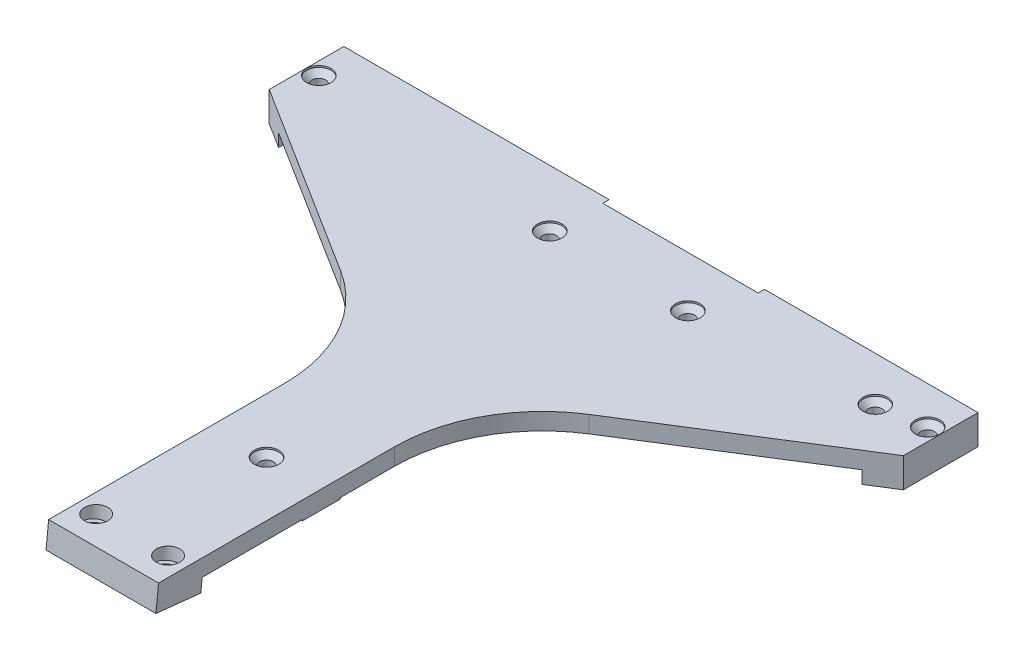
from build123d import *
from build123d.topology import SkipClean

# Parameters (mm, degrees)
BOSS_EXTRU_1_DEPTH                   = 4
BOSS_EXTRU_6_DEPTH                   = 3
ENL_V_MAT_EXTRU_9_DEPTH              = 1.5
ESQUISSE18_W                         = 26
ESQUISSE18_H                         = 4
BOSS_EXTRU_5_DEPTH                   = 3.5
ESQUISSE24_W                         = 26
ESQUISSE24_H                         = 9
ESQUISSE24_R                         = 1.6
BOSS_EXTRU_7_DEPTH                   = 0.3
ESQUISSE25_W                         = 26
ESQUISSE25_H                         = 12
BOSS_EXTRU_8_DEPTH                   = 3
ENL_V_MAT_EXTRU_13_REACH             = 155.177
ENL_V_MAT_EXTRU_13_DIRECTION_2_REACH = 155.177
ENL_V_MAT_EXTRU_14_REACH             = 155.177
ENL_V_MAT_EXTRU_14_DIRECTION_2_REACH = 155.177
ENL_V_MAT_EXTRU_15_REACH             = 161.061
ESQUISSE38_W                         = 26
ESQUISSE38_H                         = 10.68641461
ESQUISSE38_R                         = 1.6
BOSS_EXTRU_10_DEPTH                  = 0.09


# Read off the part's stored shape, not the designer's step: Fraisage pour vis à tête fraisée à 6 pans creux M31
with BuildPart() as part:
    # Esquisse1 → Boss.-Extru.1 (new body)
    with BuildSketch(Plane(origin=(0, 0, 0), x_dir=(1, 0, 0), z_dir=(0, 1, 0))):
        with BuildLine():
            Line((-13, -130), (-13, -76))
            ThreePointArc((-13, -76), (-17.360668588, -59.081626241), (-29.356078322, -46.378990826))
            Line((-29.356078322, -46.378990826), (-75, -17.65))
            Line((-75, -17.65), (-75, 0))
            Line((-75, 0), (75, 0))
            Line((75, 0), (75, -17.65))
            Line((75, -17.65), (29.356078322, -46.378990826))
            ThreePointArc((29.356078322, -46.378990826), (17.360668588, -59.081626241), (13, -76))
            Line((13, -76), (13, -130))
            Line((13, -130), (-13, -130))
        make_face()
    extrude(amount=BOSS_EXTRU_1_DEPTH)

    # Esquisse21 → Boss.-Extru.6 (add)
    with BuildSketch(Plane(origin=(0, 0, 0), x_dir=(-1, 0, 0), z_dir=(0, -1, 0))):
        Polygon((75, 0), (69, 0), (69, -21.426492874), (75, -17.65), align=None)
        Polygon((-75, 0), (-69, 0), (-69, -21.426492874), (-75, -17.65), align=None)
    extrude(amount=BOSS_EXTRU_6_DEPTH)

    # Fraisage pour vis _ t_te frais_e _ 6 2 → Fraisage pour vis à tête fraisée à 6 pans creux M31 (revolve, cut)
    with BuildSketch(Plane.XY.offset(93.29)):
        Polygon((0, 0), (1.6, 0), (1.6, 2.3), (2.9, 3.6), (2.9, 4), (0, 4), align=None)
    revolve(axis=Axis((0, 0, 93.29), (0, 1, 0)), mode=Mode.SUBTRACT)

    # Fraisage pour vis _ t_te frais_e _ 6 3 o → Fraisage pour vis _ t_te frais_e _ 6 3 (revolve, cut)
    with BuildSketch(Plane(origin=(-72, 0, 8.91), x_dir=(1, 0, 0), z_dir=(0, 0, 1))):
        Polygon((0, -3), (1.6, -3), (1.6, 2.3), (2.9, 3.6), (2.9, 4), (0, 4), align=None)
    revolve(axis=Axis((-72, 0, 8.91), (0, 1, 0)), mode=Mode.SUBTRACT)

    # Fraisage pour vis _ t_te frais_e _ 6 4 o → Fraisage pour vis _ t_te frais_e _ 6 4 (revolve, cut)
    with BuildSketch(Plane(origin=(72, 0, 8.91), x_dir=(1, 0, 0), z_dir=(0, 0, 1))):
        Polygon((0, -3), (1.6, -3), (1.6, 2.3), (2.9, 3.6), (2.9, 4), (0, 4), align=None)
    revolve(axis=Axis((72, 0, 8.91), (0, 1, 0)), mode=Mode.SUBTRACT)

    # Fraisage pour vis _ t_te frais_e _ 6 5 o → Fraisage pour vis _ t_te frais_e _ 6 5 (revolve, cut)
    with BuildSketch(Plane(origin=(19.84, 0, 13.45), x_dir=(1, 0, 0), z_dir=(0, 0, 1))):
        Polygon((0, 0), (1.6, 0), (1.6, 2.3), (2.9, 3.6), (2.9, 4), (0, 4), align=None)
    revolve(axis=Axis((19.84, 0, 13.45), (0, 1, 0)), mode=Mode.SUBTRACT)

    # Fraisage pour vis _ t_te frais_e _ 6 6 o → Fraisage pour vis _ t_te frais_e _ 6 6 (revolve, cut)
    with BuildSketch(Plane(origin=(-12.85, 0, 13.45), x_dir=(1, 0, 0), z_dir=(0, 0, 1))):
        Polygon((0, 0), (1.6, 0), (1.6, 2.3), (2.9, 3.6), (2.9, 4), (0, 4), align=None)
    revolve(axis=Axis((-12.85, 0, 13.45), (0, 1, 0)), mode=Mode.SUBTRACT)

    # Fraisage pour vis _ t_te frais_e _ 6 7 o → Fraisage pour vis _ t_te frais_e _ 6 7 (revolve, cut)
    with BuildSketch(Plane(origin=(61.15, 0, 10.45), x_dir=(1, 0, 0), z_dir=(0, 0, 1))):
        Polygon((0, 0), (1.6, 0), (1.6, 2.3), (2.9, 3.6), (2.9, 4), (0, 4), align=None)
    revolve(axis=Axis((61.15, 0, 10.45), (0, 1, 0)), mode=Mode.SUBTRACT)

    # Esquisse16 → Enlèv. mat.-Extru.9 (cut)
    with BuildSketch(Plane(origin=(0, 0, 0), x_dir=(-1, 0, 0), z_dir=(0, 0, -1))):
        Polygon((16.25, 0), (12.25, 4), (-24.5, 4), (-28.5, 0), align=None)
    extrude(amount=-ENL_V_MAT_EXTRU_9_DEPTH, mode=Mode.SUBTRACT)

    # Esquisse18 → Boss.-Extru.5 (add)
    with BuildSketch(Plane.XY.offset(130)):
        with Locations((0, 2)):
            Rectangle(ESQUISSE18_W, ESQUISSE18_H)
    extrude(amount=BOSS_EXTRU_5_DEPTH)

    # Esquisse24 → Boss.-Extru.7 (add)
    with SkipClean():  # the faces are left unmerged after this step: merging them gives an invalid solid
        with BuildSketch(Plane(origin=(0, 0, 0), x_dir=(-1, 0, 0), z_dir=(0, -1, 0))):
            with Locations((0, -93.29)):
                Rectangle(ESQUISSE24_W, ESQUISSE24_H)
            with Locations(Location((0, -93.29, 0), (0, 0, 270))):
                Circle(ESQUISSE24_R, mode=Mode.SUBTRACT)
        extrude(amount=BOSS_EXTRU_7_DEPTH)

    # Esquisse25 → Boss.-Extru.8 (add)
    with SkipClean():  # the faces are left unmerged after this step: merging them gives an invalid solid
        with BuildSketch(Plane(origin=(0, 0, 0), x_dir=(-1, 0, 0), z_dir=(0, -1, 0))):
            with Locations((0, -127.5)):
                Rectangle(ESQUISSE25_W, ESQUISSE25_H)
        extrude(amount=BOSS_EXTRU_8_DEPTH)

    # Esquisse26 → Enlèv. mat.-Extru.13 (cut, up to next)
    with BuildSketch(Plane(origin=(0, 0, 0), x_dir=(0, 0, -1), z_dir=(1, 0, 0)), mode=Mode.PRIVATE) as enl_v_mat_extru_13_sk1:
        Polygon((-121.5, -3), (-133.5, -1.738749177), (-133.5, -3), align=None)
    enl_v_mat_extru_13_tool1 = extrude(enl_v_mat_extru_13_sk1.sketch, amount=-ENL_V_MAT_EXTRU_13_REACH, mode=Mode.PRIVATE) & part.part
    add(enl_v_mat_extru_13_tool1.solids().sort_by_distance((0, -2.579583, 129.5))[0], mode=Mode.SUBTRACT)

    # Esquisse26 → Enlèv. mat.-Extru.13 direction 2 (cut, up to next)
    with BuildSketch(Plane(origin=(0, 0, 0), x_dir=(0, 0, -1), z_dir=(1, 0, 0)), mode=Mode.PRIVATE) as enl_v_mat_extru_13_direction_2_sk1:
        Polygon((-121.5, -3), (-133.5, -1.738749177), (-133.5, -3), align=None)
    enl_v_mat_extru_13_direction_2_tool1 = extrude(enl_v_mat_extru_13_direction_2_sk1.sketch, amount=ENL_V_MAT_EXTRU_13_DIRECTION_2_REACH, mode=Mode.PRIVATE) & part.part
    add(enl_v_mat_extru_13_direction_2_tool1.solids().sort_by_distance((0, -2.579583, 129.5))[0], mode=Mode.SUBTRACT)

    # Esquisse34 → Enlèv. mat.-Extru.14 (cut, up to next)
    with BuildSketch(Plane(origin=(0, 0, 0), x_dir=(0, 0, -1), z_dir=(1, 0, 0)), mode=Mode.PRIVATE) as enl_v_mat_extru_14_sk1:
        Polygon((-133.5, 4), (-131.824861428, 4), (-132.439740849, -1.850186904), (-133.5, -1.738749177), align=None)
    enl_v_mat_extru_14_tool1 = extrude(enl_v_mat_extru_14_sk1.sketch, amount=-ENL_V_MAT_EXTRU_14_REACH, mode=Mode.PRIVATE) & part.part
    add(enl_v_mat_extru_14_tool1.solids().sort_by_distance((0, 1.317192, 132.802089))[0], mode=Mode.SUBTRACT)

    # Esquisse34 → Enlèv. mat.-Extru.14 direction 2 (cut, up to next)
    with BuildSketch(Plane(origin=(0, 0, 0), x_dir=(0, 0, -1), z_dir=(1, 0, 0)), mode=Mode.PRIVATE) as enl_v_mat_extru_14_direction_2_sk1:
        Polygon((-133.5, 4), (-131.824861428, 4), (-132.439740849, -1.850186904), (-133.5, -1.738749177), align=None)
    enl_v_mat_extru_14_direction_2_tool1 = extrude(enl_v_mat_extru_14_direction_2_sk1.sketch, amount=ENL_V_MAT_EXTRU_14_DIRECTION_2_REACH, mode=Mode.PRIVATE) & part.part
    add(enl_v_mat_extru_14_direction_2_tool1.solids().sort_by_distance((0, 1.317192, 132.802089))[0], mode=Mode.SUBTRACT)

    # Esquisse33 → Enlèvement de matière-Révolution1 (revolve, cut)
    with SkipClean():  # the faces are left unmerged after this step: merging them gives an invalid solid
        with BuildSketch(Plane(origin=(8.5, 0, 0), x_dir=(0, 0, -1), z_dir=(1, 0, 0))):
            Polygon((-124.928461333, 5.421822245), (-125.766498931, -2.551572893), (-127.357733964, -2.384327351), (-126.939620111, 1.59376023), (-128.08332029, 1.713967963), (-127.885090335, 3.6), (-127.663396545, 5.709275519), align=None)
        enl_vement_de_mati_re_r_volution1 = revolve(axis=Axis((8.5, 5.421822245, 124.928461333), (0, -0.9945218953682737, 0.10452846326764909)), mode=Mode.SUBTRACT)

    # Symétrie1: Enlèvement de matière-Révolution1 across plane
    with SkipClean():  # the faces are left unmerged after this step: merging them gives an invalid solid
        add(enl_vement_de_mati_re_r_volution1.mirror(Plane(origin=(0, 0, 0), x_dir=(0, 0, 1), z_dir=(1, 0, 0))), mode=Mode.SUBTRACT)

    # Esquisse37 → Enlèv. mat.-Extru.15 (cut, up to next)
    with BuildSketch(Plane(origin=(13, 0, 0), x_dir=(0, 0, -1), z_dir=(1, 0, 0)), mode=Mode.PRIVATE) as enl_v_mat_extru_15_sk1:
        Polygon((-121.5, 0), (-121.811867536, -2.967221401), (-121.5, -3), align=None)
    enl_v_mat_extru_15_tool1 = extrude(enl_v_mat_extru_15_sk1.sketch, amount=-ENL_V_MAT_EXTRU_15_REACH, mode=Mode.PRIVATE) & part.part
    add(enl_v_mat_extru_15_tool1.solids().sort_by_distance((13, -1.989074, 121.603956))[0], mode=Mode.SUBTRACT)

    # Esquisse38 → Boss.-Extru.10 (add)
    with SkipClean():  # the faces are left unmerged after this step: merging them gives an invalid solid
        with BuildSketch(Plane(origin=(0, -15.597856618, 1.639400792), x_dir=(1, 0, 0), z_dir=(0, -0.9945218953682737, 0.10452846326765036))):
            with Locations((0, 126.177617592)):
                Rectangle(ESQUISSE38_W, ESQUISSE38_H)
            with Locations(Location((-8.5, 124.810824897, 0), (0, 0, 90))):
                Circle(ESQUISSE38_R, mode=Mode.SUBTRACT)
            with Locations(Location((8.5, 124.810824897, 0), (0, 0, 90))):
                Circle(ESQUISSE38_R, mode=Mode.SUBTRACT)
        extrude(amount=BOSS_EXTRU_10_DEPTH)


solid = part.part
